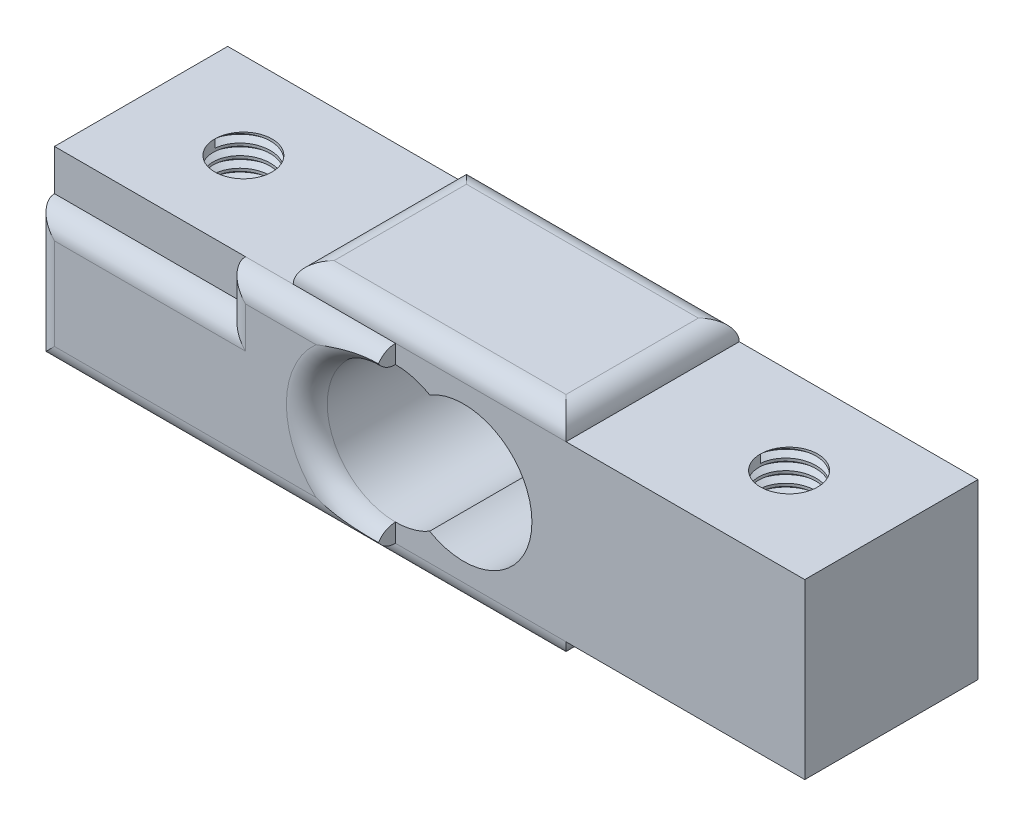
from build123d import *

# Parameters (mm, degrees)
SKETCH2_W                   = 55
SKETCH2_H                   = 12.7
BOSS_EXTRUDE1_DEPTH         = 12.7
SKETCH4_R                   = 5
CUT_EXTRUDE2_DEPTH          = 12.7
SKETCH5_W                   = 20
SKETCH5_H                   = 12.7
BOSS_EXTRUDE2_DEPTH         = 1.5
TAP_DRILL_FOR_M5X0_8_TAP1_D = 4.2
FILLET1_R                   = 1.5
SKETCH6_W                   = 20
SKETCH6_H                   = 12.7
BOSS_EXTRUDE3_DEPTH         = 1.5
FILLET2_R                   = 1.5
BOSS_EXTRUDE4_START         = 1.5
BOSS_EXTRUDE4_DEPTH         = 1.5
FILLET3_R                   = 1.5
THREAD2_PITCH               = 0.8
THREAD3_PITCH               = 0.8


# Some blends are built 0.0001 mm under size
with BuildPart() as part:
    # Sketch2 → Boss-Extrude1 (new body)
    with BuildSketch(Plane.XY):
        Rectangle(SKETCH2_W, SKETCH2_H)
    extrude(amount=BOSS_EXTRUDE1_DEPTH)

    # Sketch4 → Cut-Extrude2 (cut)
    with BuildSketch(Plane.XY.offset(12.7)):
        with Locations((-2.5, 0)):
            Circle(SKETCH4_R)
        with Locations((2.5, 0)):
            Circle(SKETCH4_R)
    extrude(amount=-CUT_EXTRUDE2_DEPTH, mode=Mode.SUBTRACT)

    # Sketch5 → Boss-Extrude2 (add)
    with BuildSketch(Plane(origin=(0, 6.35, 0), x_dir=(1, 0, 0), z_dir=(0, 1, 0))):
        with Locations((0, -6.35)):
            Rectangle(SKETCH5_W, SKETCH5_H)
    extrude(amount=BOSS_EXTRUDE2_DEPTH)

    # Tap Drill for M5x0.8 Tap1 (through all)
    with Locations(Plane(origin=(-20, 6.35, 6.35), x_dir=(0, 0, 1), z_dir=(0, 1, 0))):
        with Locations((0, 0), (0, 40)):
            Hole(TAP_DRILL_FOR_M5X0_8_TAP1_D / 2)

    # Fillet1
    fillet1_edges = [part.edges().sort_by_distance(p)[0] for p in [
        (0, 7.85, 0),
        (10, 7.85, 6.35),
        (-10, 7.85, 6.35),
        (0, 7.85, 12.7),
    ]]
    fillet(fillet1_edges, radius=FILLET1_R - 0.0001)  # a hair under: the kernel refuses the full size

    # Sketch6 → Boss-Extrude3 (add)
    with BuildSketch(Plane(origin=(0, -6.35, 0), x_dir=(-1, 0, 0), z_dir=(0, -1, 0))):
        with Locations((0, -6.35)):
            Rectangle(SKETCH6_W, SKETCH6_H)
    extrude(amount=BOSS_EXTRUDE3_DEPTH)

    # Fillet2
    fillet2_edges = [part.edges().sort_by_distance(p)[0] for p in [
        (0, -7.85, 12.7),
        (10, -7.85, 6.35),
        (-10, -7.85, 6.35),
        (0, -7.85, 0),
    ]]
    fillet(fillet2_edges, radius=FILLET2_R - 0.0001)  # a hair under: the kernel refuses the full size

    # Sketch7 → Boss-Extrude4 (add)
    with BuildSketch(Plane.XY.offset(12.7).offset(BOSS_EXTRUDE4_START)):
        with BuildLine():
            Line((-2.5, -6.35), (-2.5, -5))
            ThreePointArc((-2.5, -5), (-7.5, 0), (-2.5, 5))
            Line((-2.5, 5), (-2.5, 6.35))
            Line((-2.5, 6.35), (-13.5, 6.35))
            Line((-13.5, 6.35), (-13.5, 3.35))
            Line((-13.5, 3.35), (-27.5, 3.35))
            Line((-27.5, 3.35), (-27.5, -6.35))
            Line((-27.5, -6.35), (-2.5, -6.35))
        make_face()
    extrude(amount=-BOSS_EXTRUDE4_DEPTH)

    # Fillet3
    # the kernel refuses this fillet: 1.5 mm, written as the material it takes off along each edge
    with BuildSketch(Plane(origin=(1.25, 6.35, 14.2), x_dir=(0, -1, 0), z_dir=(-1, 0, 0))) as fillet3_piece_1:
        with BuildLine():
            CenterArc((FILLET3_R, -FILLET3_R), FILLET3_R, 90, 90)
            Line((0, -FILLET3_R), (0, 0))
            Line((0, 0), (FILLET3_R, 0))
        make_face()
    extrude(amount=18.5, mode=Mode.SUBTRACT)
    with BuildSketch(Plane(origin=(-13.5, 10.1, 14.2), x_dir=(1, 0, 0), z_dir=(0, -1, 0))) as fillet3_piece_2:
        with BuildLine():
            CenterArc((FILLET3_R, -FILLET3_R), FILLET3_R, 90, 90)
            Line((0, -FILLET3_R), (0, 0))
            Line((0, 0), (FILLET3_R, 0))
        make_face()
    extrude(amount=6.75, mode=Mode.SUBTRACT)
    with BuildSketch(Plane(origin=(-13.5, 3.35, 14.2), x_dir=(0, -1, 0), z_dir=(-1, 0, 0))) as fillet3_piece_3:
        with BuildLine():
            CenterArc((FILLET3_R, -FILLET3_R), FILLET3_R, 90, 90)
            Line((0, -FILLET3_R), (0, 0))
            Line((0, 0), (FILLET3_R, 0))
        make_face()
    extrude(amount=17.75, mode=Mode.SUBTRACT)
    with BuildSketch(Plane(origin=(-31.25, -6.35, 14.2), x_dir=(0, 1, 0), z_dir=(1, 0, 0))) as fillet3_piece_4:
        with BuildLine():
            CenterArc((FILLET3_R, -FILLET3_R), FILLET3_R, 90, 90)
            Line((0, -FILLET3_R), (0, 0))
            Line((0, 0), (FILLET3_R, 0))
        make_face()
    extrude(amount=32.5, mode=Mode.SUBTRACT)
    with BuildSketch(Plane(origin=(-27.5, 7.1, 14.2), x_dir=(1, 0, 0), z_dir=(0, -1, 0))) as fillet3_piece_5:
        with BuildLine():
            CenterArc((FILLET3_R, -FILLET3_R), FILLET3_R, 90, 90)
            Line((0, -FILLET3_R), (0, 0))
            Line((0, 0), (FILLET3_R, 0))
        make_face()
    extrude(amount=17.2, mode=Mode.SUBTRACT)
    with BuildSketch(Plane(origin=(-2.5, 0, 14.2), x_dir=(0.682520784531695, -0.7308661838409543, 0), z_dir=(0.7308661838409543, 0.682520784531695, 0))) as fillet3_piece_6:
        with BuildLine():
            CenterArc((5 + FILLET3_R, FILLET3_R), FILLET3_R, 180, 90)
            Line((5 + FILLET3_R, 0), (5, 0))
            Line((5, 0), (5, FILLET3_R))
        make_face()
    revolve(axis=Axis((-2.5, 0, 14.2), (0, 0, -1)), revolution_arc=266.08188294, mode=Mode.SUBTRACT)
    with BuildSketch(Plane(origin=(-13.5, 10.1, 14.2), x_dir=(1, 0, 0), z_dir=(0, -1, 0))) as fillet3_piece_7a_section:
        with BuildLine():
            CenterArc((FILLET3_R, -FILLET3_R), FILLET3_R, 90, 90)
            Line((0, -FILLET3_R), (0, 0))
            Line((0, 0), (FILLET3_R, 0))
        make_face()
    fillet3_piece_7a = extrude(amount=10.5, mode=Mode.PRIVATE)
    fillet3_piece_7a = split(fillet3_piece_7a, bisect_by=Plane(origin=(-13.160407329, 3.35, 13.860407329), z_dir=(0, -1, 0)), keep=Keep.TOP, mode=Mode.PRIVATE)
    with BuildSketch(Plane(origin=(-9.75, 3.35, 14.2), x_dir=(0, -1, 0), z_dir=(-1, 0, 0))) as fillet3_piece_7b_section:
        with BuildLine():
            CenterArc((FILLET3_R, -FILLET3_R), FILLET3_R, 90, 90)
            Line((0, -FILLET3_R), (0, 0))
            Line((0, 0), (FILLET3_R, 0))
        make_face()
    fillet3_piece_7b = extrude(amount=21.5, mode=Mode.PRIVATE)
    fillet3_piece_7b = split(fillet3_piece_7b, bisect_by=Plane(origin=(-13.5, 3.010407329, 13.860407329), z_dir=(1, 0, 0)), keep=Keep.TOP, mode=Mode.PRIVATE)
    fillet3_piece_7 = fillet3_piece_7a & fillet3_piece_7b
    add(fillet3_piece_7, mode=Mode.SUBTRACT)

    # Thread2: the profile of Thread Profile2 profile screwed along a right-hand helix of 15.875 turns, 8 arcs to a turn; built about Z, then put on its axis
    thread2_z = Axis((0, 0, 0), (0, 0, 1))
    thread2_corners = [(2.0997, 0, -0.000173205), (2.5330127, 0, 0.249999999), (2.5330127, 0, 0.349999999), (2.0997, 0, 0.600173203)]
    with BuildLine(mode=Mode.PRIVATE) as thread2_profile:
        Line(thread2_corners[0], thread2_corners[1])
        Line(thread2_corners[1], thread2_corners[2])
        Line(thread2_corners[2], thread2_corners[3])
        Line(thread2_corners[3], thread2_corners[0])
    thread2_cap = Face(thread2_profile.wire())
    thread2_turn_angles = [0, 22.5, 45, 67.5, 90, 112.5, 135, 157.5, 180, 202.5, 225, 247.5, 270, 292.5, 315, 337.5, 360]
    thread2_turn_weights = [1, 0.9238795325112867, 1, 0.9238795325112867, 1, 0.9238795325112867, 1, 0.9238795325112867, 1, 0.9238795325112867, 1, 0.9238795325112867, 1, 0.9238795325112867, 1, 0.9238795325112867, 1]
    thread2_turn_rails = [Edge.make_bspline([Vector(p[0], p[1], 0).rotate(thread2_z, thread2_turn_angles[k]) / thread2_turn_weights[k] + Vector(0, 0, p[2] + THREAD2_PITCH * thread2_turn_angles[k] / 360) for k in range(17)], [0, 0, 0, 1, 1, 2, 2, 3, 3, 4, 4, 5, 5, 6, 6, 7, 7, 8, 8, 8], 2, thread2_turn_weights) for p in thread2_corners]
    thread2_turn_sides = [Face.make_surface_from_curves(thread2_turn_rails[p[0]], thread2_turn_rails[p[1]]) for p in [(0, 1), (1, 2), (2, 3), (3, 0)]]
    thread2_last_angles = [5400, 5422.5, 5445, 5467.5, 5490, 5512.5, 5535, 5557.5, 5580, 5602.5, 5625, 5647.5, 5670, 5692.5, 5715]
    thread2_last_weights = [1, 0.9238795325112867, 1, 0.9238795325112867, 1, 0.9238795325112867, 1, 0.9238795325112867, 1, 0.9238795325112867, 1, 0.9238795325112867, 1, 0.9238795325112867, 1]
    thread2_last_rails = [Edge.make_bspline([Vector(p[0], p[1], 0).rotate(thread2_z, thread2_last_angles[k]) / thread2_last_weights[k] + Vector(0, 0, p[2] + THREAD2_PITCH * thread2_last_angles[k] / 360) for k in range(15)], [0, 0, 0, 1, 1, 2, 2, 3, 3, 4, 4, 5, 5, 6, 6, 7, 7, 7], 2, thread2_last_weights) for p in thread2_corners]
    thread2_last_sides = [Face.make_surface_from_curves(thread2_last_rails[p[0]], thread2_last_rails[p[1]]) for p in [(0, 1), (1, 2), (2, 3), (3, 0)]]
    thread2 = Plane(origin=(20, 6.35, 6.35), x_dir=(-1, 0, 0), z_dir=(0, -1, 0)) * Solid(Shell([*[p.moved(Location((0, 0, THREAD2_PITCH * i))) for i in range(15) for p in thread2_turn_sides], *thread2_last_sides, thread2_cap, thread2_cap.rotate(thread2_z, 5715).moved(Location((0, 0, THREAD2_PITCH * 5715 / 360)))]))
    add(thread2, mode=Mode.SUBTRACT)

    # Thread3: the profile of Thread Profile3 profile screwed along a right-hand helix of 15.875 turns, 8 arcs to a turn; built about Z, then put on its axis
    thread3_z = Axis((0, 0, 0), (0, 0, 1))
    thread3_corners = [(2.0997, 0, -0.000173205), (2.5330127, 0, 0.249999999), (2.5330127, 0, 0.349999999), (2.0997, 0, 0.600173203)]
    with BuildLine(mode=Mode.PRIVATE) as thread3_profile:
        Line(thread3_corners[0], thread3_corners[1])
        Line(thread3_corners[1], thread3_corners[2])
        Line(thread3_corners[2], thread3_corners[3])
        Line(thread3_corners[3], thread3_corners[0])
    thread3_cap = Face(thread3_profile.wire())
    thread3_turn_angles = [0, 22.5, 45, 67.5, 90, 112.5, 135, 157.5, 180, 202.5, 225, 247.5, 270, 292.5, 315, 337.5, 360]
    thread3_turn_weights = [1, 0.9238795325112867, 1, 0.9238795325112867, 1, 0.9238795325112867, 1, 0.9238795325112867, 1, 0.9238795325112867, 1, 0.9238795325112867, 1, 0.9238795325112867, 1, 0.9238795325112867, 1]
    thread3_turn_rails = [Edge.make_bspline([Vector(p[0], p[1], 0).rotate(thread3_z, thread3_turn_angles[k]) / thread3_turn_weights[k] + Vector(0, 0, p[2] + THREAD3_PITCH * thread3_turn_angles[k] / 360) for k in range(17)], [0, 0, 0, 1, 1, 2, 2, 3, 3, 4, 4, 5, 5, 6, 6, 7, 7, 8, 8, 8], 2, thread3_turn_weights) for p in thread3_corners]
    thread3_turn_sides = [Face.make_surface_from_curves(thread3_turn_rails[p[0]], thread3_turn_rails[p[1]]) for p in [(0, 1), (1, 2), (2, 3), (3, 0)]]
    thread3_last_angles = [5400, 5422.5, 5445, 5467.5, 5490, 5512.5, 5535, 5557.5, 5580, 5602.5, 5625, 5647.5, 5670, 5692.5, 5715]
    thread3_last_weights = [1, 0.9238795325112867, 1, 0.9238795325112867, 1, 0.9238795325112867, 1, 0.9238795325112867, 1, 0.9238795325112867, 1, 0.9238795325112867, 1, 0.9238795325112867, 1]
    thread3_last_rails = [Edge.make_bspline([Vector(p[0], p[1], 0).rotate(thread3_z, thread3_last_angles[k]) / thread3_last_weights[k] + Vector(0, 0, p[2] + THREAD3_PITCH * thread3_last_angles[k] / 360) for k in range(15)], [0, 0, 0, 1, 1, 2, 2, 3, 3, 4, 4, 5, 5, 6, 6, 7, 7, 7], 2, thread3_last_weights) for p in thread3_corners]
    thread3_last_sides = [Face.make_surface_from_curves(thread3_last_rails[p[0]], thread3_last_rails[p[1]]) for p in [(0, 1), (1, 2), (2, 3), (3, 0)]]
    thread3 = Plane(origin=(-20, 6.35, 6.35), x_dir=(-1, 0, 0), z_dir=(0, -1, 0)) * Solid(Shell([*[p.moved(Location((0, 0, THREAD3_PITCH * i))) for i in range(15) for p in thread3_turn_sides], *thread3_last_sides, thread3_cap, thread3_cap.rotate(thread3_z, 5715).moved(Location((0, 0, THREAD3_PITCH * 5715 / 360)))]))
    add(thread3, mode=Mode.SUBTRACT)


solid = part.part
